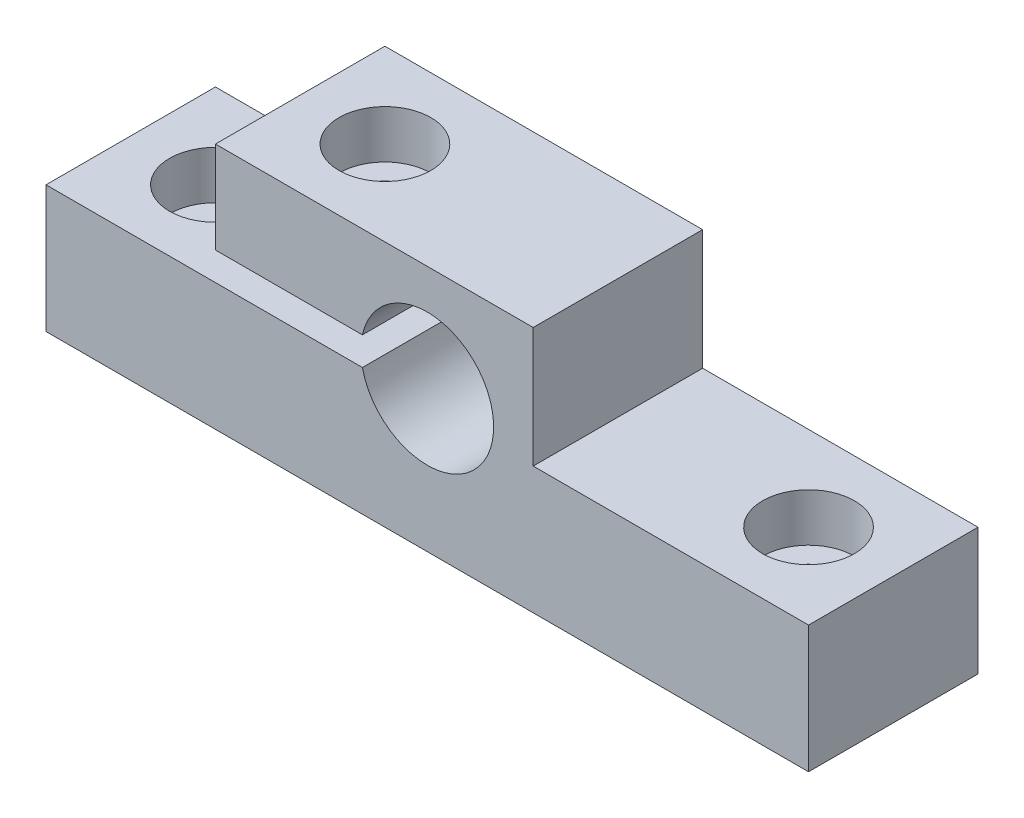
from build123d import *

# Parameters (mm, degrees)
AUFSATZ_LINEAR_AUSTRAGEN1_DEPTH                = 12
SKIZZE4_R                                      = 4.7
SCHNITT_LINEAR_AUSTRAGEN1_DEPTH                = 8.5
STIRNSENKUNG_START                             = 5.6
STIRNSENKUNG_F_R_M3_ZYLINDERSCHRAUBE_2_R       = 3.25
STIRNSENKUNG_F_R_M3_ZYLINDERSCHRAUBE_MIT_DEPTH = 3.4
STIRNSENKUNG_START_2                           = 14.1
STIRNSENKUNG_F_R_M3_ZYLINDERSCHRAUBE_3_O_R     = 3.25
STIRNSENKUNG_F_R_M3_ZYLINDERSCHRAUBE_3_DEPTH   = 3.4
STIRNSENKUNG_F_R_M3_ZYLINDERSCHRAUBE_4_O_R     = 1.6
STIRNSENKUNG_F_R_M3_ZYLINDERSCHRAUBE_4_DEPTH   = 5.6
STIRNSENKUNG_START_3                           = 11
STIRNSENKUNG_F_R_M3_ZYLINDERSCHRAUBE_5_O_R     = 1.6
STIRNSENKUNG_F_R_M3_ZYLINDERSCHRAUBE_5_DEPTH   = 3.1


# Read off the part's stored shape, not the designer's step: Stirnsenkung für M3 Zylinderschraube mit Innensechskant1
with BuildPart() as part:
    # Skizze1 → Aufsatz-Linear austragen1 (new body)
    with BuildSketch(Plane.XY):
        with BuildLine():
            Line((0, 0), (54, 0))
            Line((54, 0), (54, 9))
            Line((54, 9), (34.5, 9))
            Line((34.5, 9), (34.5, 17.5))
            Line((34.5, 17.5), (12, 17.5))
            Line((12, 17.5), (12, 11))
            Line((12, 11), (22.998047352, 11))
            ThreePointArc((22.998047352, 11), (31.125, 10), (22.998047352, 9))
            Line((22.998047352, 9), (0, 9))
            Line((0, 9), (0, 0))
        make_face()
    extrude(amount=AUFSATZ_LINEAR_AUSTRAGEN1_DEPTH)

    # Skizze4 → Schnitt-Linear austragen1 (cut)
    with BuildSketch(Plane.XY.offset(12)):
        with Locations((27, 10)):
            Circle(SKIZZE4_R)
    extrude(amount=-SCHNITT_LINEAR_AUSTRAGEN1_DEPTH, mode=Mode.SUBTRACT)

    # Stirnsenkung f_r M3 Zylinderschraube 2 → Stirnsenkung für M3 Zylinderschraube mit Innensechskant1 (cut)
    with BuildSketch(Plane(origin=(0, 0, 0), x_dir=(1, 0, 0), z_dir=(0, 1, 0)).offset(STIRNSENKUNG_START)):
        with Locations((48, -6)):
            Circle(STIRNSENKUNG_F_R_M3_ZYLINDERSCHRAUBE_2_R)
        with Locations((6, -6)):
            Circle(STIRNSENKUNG_F_R_M3_ZYLINDERSCHRAUBE_2_R)
    extrude(amount=STIRNSENKUNG_F_R_M3_ZYLINDERSCHRAUBE_MIT_DEPTH, mode=Mode.SUBTRACT)

    # Stirnsenkung f_r M3 Zylinderschraube 3 o → Stirnsenkung f_r M3 Zylinderschraube 3 (cut)
    with BuildSketch(Plane(origin=(0, 0, 0), x_dir=(1, 0, 0), z_dir=(0, 1, 0)).offset(STIRNSENKUNG_START_2)):
        with Locations((18, -6)):
            Circle(STIRNSENKUNG_F_R_M3_ZYLINDERSCHRAUBE_3_O_R)
    extrude(amount=STIRNSENKUNG_F_R_M3_ZYLINDERSCHRAUBE_3_DEPTH, mode=Mode.SUBTRACT)

    # Stirnsenkung f_r M3 Zylinderschraube 4 o → Stirnsenkung f_r M3 Zylinderschraube 4 (cut)
    with BuildSketch(Plane(origin=(0, 0, 0), x_dir=(1, 0, 0), z_dir=(0, 1, 0))):
        with Locations((48, -6)):
            Circle(STIRNSENKUNG_F_R_M3_ZYLINDERSCHRAUBE_4_O_R)
        with Locations((6, -6)):
            Circle(STIRNSENKUNG_F_R_M3_ZYLINDERSCHRAUBE_4_O_R)
    extrude(amount=STIRNSENKUNG_F_R_M3_ZYLINDERSCHRAUBE_4_DEPTH, mode=Mode.SUBTRACT)

    # Stirnsenkung f_r M3 Zylinderschraube 5 o → Stirnsenkung f_r M3 Zylinderschraube 5 (cut)
    with BuildSketch(Plane(origin=(0, 0, 0), x_dir=(1, 0, 0), z_dir=(0, 1, 0)).offset(STIRNSENKUNG_START_3)):
        with Locations((18, -6)):
            Circle(STIRNSENKUNG_F_R_M3_ZYLINDERSCHRAUBE_5_O_R)
    extrude(amount=STIRNSENKUNG_F_R_M3_ZYLINDERSCHRAUBE_5_DEPTH, mode=Mode.SUBTRACT)


solid = part.part
